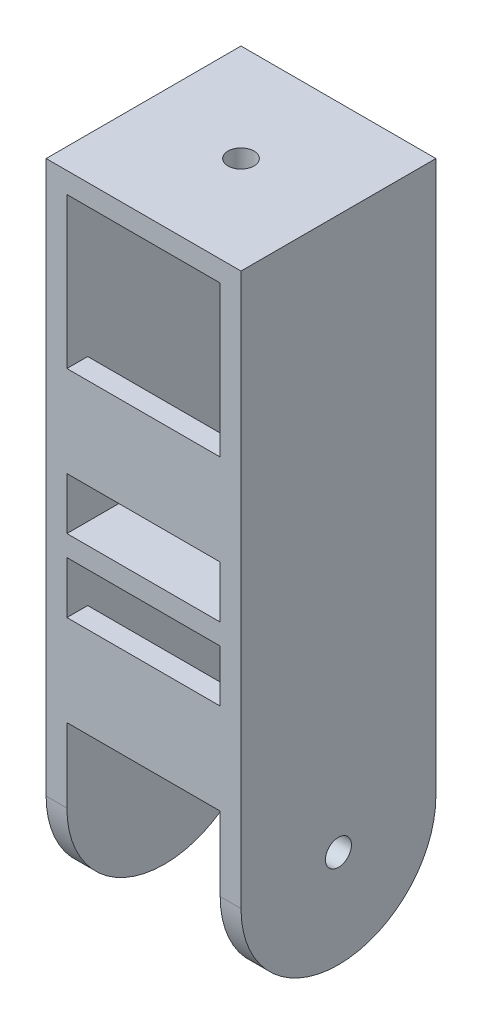
from build123d import *

# Parameters (mm, degrees)
SKETCH1_W           = 59
SKETCH1_H           = 8
BOSS_EXTRUDE2_DEPTH = 75
FILLET1_R           = 37.5
SKETCH2_R           = 5
CUT_EXTRUDE1_DEPTH  = 10
SKETCH3_R           = 15
SKETCH3_R_2         = 5
BOSS_EXTRUDE3_DEPTH = 7.5
SKETCH4_R           = 10
SKETCH4_R_2         = 5
BOSS_EXTRUDE4_DEPTH = 7.5
SKETCH5_R           = 5
CUT_EXTRUDE2_DEPTH  = 10
SKETCH6_W           = 75
SKETCH6_H           = 35
BOSS_EXTRUDE5_DEPTH = 8
SKETCH7_W           = 59
SKETCH7_H           = 35
BOSS_EXTRUDE6_DEPTH = 8


with BuildPart() as part:
    # Sketch1 → Boss-Extrude2 (new body)
    with BuildSketch(Plane.XY):
        Polygon((8, -8), (8, -250), (0, -250), (0, 0), (75, 0), (75, -250), (67, -250), (67, -8), align=None)
        with Locations((37.5, -125)):
            Rectangle(SKETCH1_W, SKETCH1_H)
    extrude(amount=BOSS_EXTRUDE2_DEPTH)

    # Fillet1
    fillet1_edges = [part.edges().sort_by_distance(p)[0] for p in [
        (4, -250, 0),
        (71, -250, 0),
        (71, -250, 75),
        (4, -250, 75),
    ]]
    fillet(fillet1_edges, radius=FILLET1_R - 0.0001)  # a hair under: the kernel refuses the full size

    # Sketch2 → Cut-Extrude1 (cut)
    with BuildSketch(Plane(origin=(75, 0, 0), x_dir=(0, 0, -1), z_dir=(1, 0, 0))):
        with Locations(Location((-37.5, -212.5, 0), (0, 0, 90))):
            Circle(SKETCH2_R)
    extrude(amount=-CUT_EXTRUDE1_DEPTH, mode=Mode.SUBTRACT)

    # Sketch3 → Boss-Extrude3 (add)
    with BuildSketch(Plane.ZY.offset(-67)):
        with Locations(Location((37.5, -212.5, 0), (0, 0, 90))):
            Circle(SKETCH3_R)
        with Locations(Location((37.5, -212.5, 0), (0, 0, 90))):
            Circle(SKETCH3_R_2, mode=Mode.SUBTRACT)
    extrude(amount=BOSS_EXTRUDE3_DEPTH)

    # Sketch4 → Boss-Extrude4 (add)
    with BuildSketch(Plane.ZY.offset(-59.5)):
        with Locations(Location((37.5, -212.5, 0), (0, 0, 270))):
            Circle(SKETCH4_R)
        with Locations(Location((37.5, -212.5, 0), (0, 0, 90))):
            Circle(SKETCH4_R_2, mode=Mode.SUBTRACT)
    extrude(amount=BOSS_EXTRUDE4_DEPTH)

    # Sketch5 → Cut-Extrude2 (cut)
    with BuildSketch(Plane(origin=(0, 0, 0), x_dir=(1, 0, 0), z_dir=(0, 1, 0))):
        with Locations(Location((37.5, -37.5, 0), (0, 0, 180))):
            Circle(SKETCH5_R)
    extrude(amount=-CUT_EXTRUDE2_DEPTH, mode=Mode.SUBTRACT)

    # Sketch6 → Boss-Extrude5 (add)
    with BuildSketch(Plane(origin=(0, 0, 0), x_dir=(-1, 0, 0), z_dir=(0, 0, -1))):
        with Locations((-37.5, -83.5)):
            Rectangle(SKETCH6_W, SKETCH6_H)
        with Locations((-37.5, -166.5)):
            Rectangle(SKETCH6_W, SKETCH6_H)
    extrude(amount=-BOSS_EXTRUDE5_DEPTH)

    # Sketch7 → Boss-Extrude6 (add)
    with BuildSketch(Plane.XY.offset(75)):
        with Locations((37.5, -83.5)):
            Rectangle(SKETCH7_W, SKETCH7_H)
        with Locations((37.5, -166.5)):
            Rectangle(SKETCH7_W, SKETCH7_H)
    extrude(amount=-BOSS_EXTRUDE6_DEPTH)


solid = part.part
